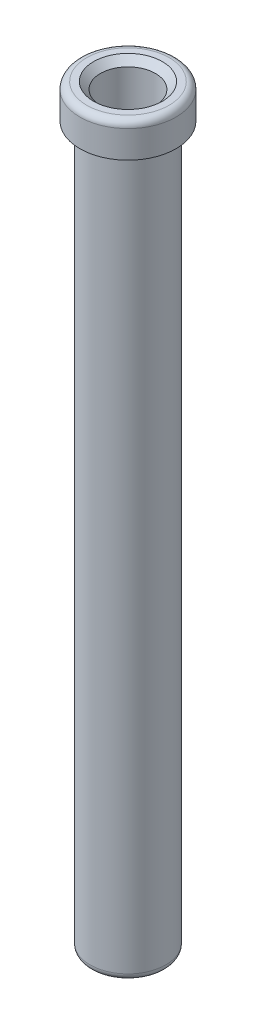
from build123d import *

# Parameters (mm, degrees)
SKETCH1_R                       = 2.8067
BOSS_EXTRUDE1_DEPTH             = 55.88
F_20_0_161_DIAMETER_HOLE1_D     = 4.0894
F_20_0_161_DIAMETER_HOLE1_DEPTH = 52.07
F_20_0_161_DIAMETER_HOLE1_TIP   = 1.228579708
BOSS_EXTRUDE2_START             = -2.54
SKETCH5_R                       = 3.5687
SKETCH5_R_2                     = 2.8067
BOSS_EXTRUDE2_DEPTH             = 2.54
CHAMFER1_SIZE                   = 0.508
FILLET1_R                       = 0.508
FILLET2_R                       = 0.508


with BuildPart() as part:
    # Sketch1 → Boss-Extrude1 (new body)
    with BuildSketch(Plane(origin=(0, 0, 0), x_dir=(1, 0, 0), z_dir=(0, 1, 0))):
        Circle(SKETCH1_R)
    extrude(amount=BOSS_EXTRUDE1_DEPTH)

    # #20 (0.161) Diameter Hole1
    with Locations(Plane.ZX.offset(55.88)):
        with Locations((0, 0)):
            Hole(F_20_0_161_DIAMETER_HOLE1_D / 2, depth=F_20_0_161_DIAMETER_HOLE1_DEPTH)
            with Locations((0, 0, -(F_20_0_161_DIAMETER_HOLE1_DEPTH + F_20_0_161_DIAMETER_HOLE1_TIP / 2))):  # 118° drill point
                Cone(0, F_20_0_161_DIAMETER_HOLE1_D / 2, F_20_0_161_DIAMETER_HOLE1_TIP, mode=Mode.SUBTRACT)

    # Sketch5 → Boss-Extrude2 (add)
    with BuildSketch(Plane(origin=(0, 55.88, 0), x_dir=(1, 0, 0), z_dir=(0, 1, 0)).offset(BOSS_EXTRUDE2_START)):
        Circle(SKETCH5_R)
        Circle(SKETCH5_R_2, mode=Mode.SUBTRACT)
    extrude(amount=BOSS_EXTRUDE2_DEPTH)

    # Chamfer1
    chamfer1_edges = [part.edges().sort_by_distance(p)[0] for p in [
        (0, 55.88, 2.0447),
    ]]
    chamfer(chamfer1_edges, length=CHAMFER1_SIZE)

    # Fillet1
    fillet1_edges = [part.edges().sort_by_distance(p)[0] for p in [
        (-2.8067, 0, 0),
    ]]
    fillet(fillet1_edges, radius=FILLET1_R)

    # Fillet2
    fillet2_edges = [part.edges().sort_by_distance(p)[0] for p in [
        (-3.5687, 55.88, 0),
    ]]
    fillet(fillet2_edges, radius=FILLET2_R)


solid = part.part
